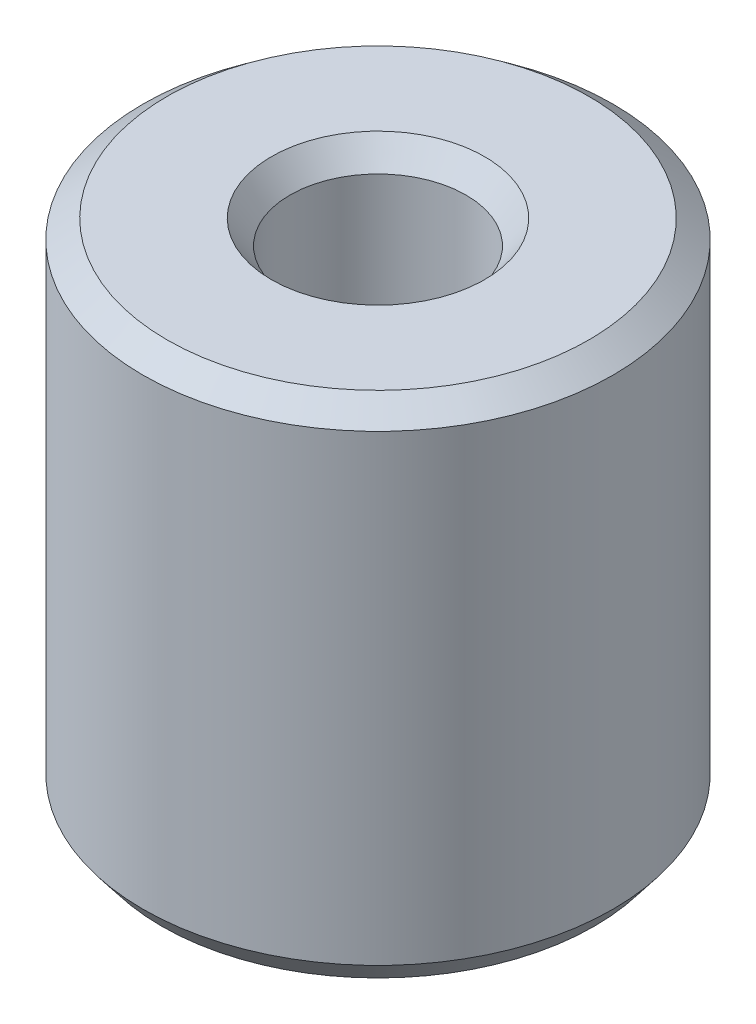
from build123d import *
from OCP.BRepFilletAPI import BRepFilletAPI_MakeChamfer

# Parameters (mm, degrees)
SKETCH1_R           = 7.5
BOSS_EXTRUDE1_DEPTH = 16.125207537
SKETCH2_R           = 2.811035462
CUT_EXTRUDE1_DEPTH  = 20.300837238
CHAMFER1_SIZE       = 0.592734587
CHAMFER1_SIZE2      = 0.766089051


with BuildPart() as part:
    # Sketch1 → Boss-Extrude1 (new body)
    with BuildSketch(Plane(origin=(0, 0, 0), x_dir=(1, 0, 0), z_dir=(0, 1, 0))):
        Circle(SKETCH1_R)
    extrude(amount=BOSS_EXTRUDE1_DEPTH)

    # Sketch2 → Cut-Extrude1 (cut, through all)
    with BuildSketch(Plane(origin=(0, 0, 0), x_dir=(1, 0, 0), z_dir=(0, 1, 0))):
        Circle(SKETCH2_R)
    extrude(amount=CUT_EXTRUDE1_DEPTH, mode=Mode.SUBTRACT)

    # Chamfer1: one chamfer whose edges measure the first distance from different faces: ONE call of the kernel's chamfer builder (chamfer() names one face for all edges)
    chamfer1_edges_1 = [part.edges().sort_by_distance(p)[0] for p in [
        (-2.811035462, 16.125207537, 0),
    ]]
    chamfer1_side_1 = [part.faces().sort_by_distance(p)[0] for p in [
        (-7.287867966, 16.125207537, 0),
    ]]
    chamfer1_edges_2 = [part.edges().sort_by_distance(p)[0] for p in [
        (-2.811035462, 0, 0),
    ]]
    chamfer1_side_2 = [part.faces().sort_by_distance(p)[0] for p in [
        (-2.811035462, 8.062603768, 0),
    ]]
    chamfer1_edges_3 = [part.edges().sort_by_distance(p)[0] for p in [
        (-7.5, 0, 0),
    ]]
    chamfer1_side_3 = [part.faces().sort_by_distance(p)[0] for p in [
        (-7.287867966, 0, 0),
    ]]
    chamfer1_edges_4 = [part.edges().sort_by_distance(p)[0] for p in [
        (-7.5, 16.125207537, 0),
    ]]
    chamfer1_side_4 = [part.faces().sort_by_distance(p)[0] for p in [
        (-7.5, 8.062603768, 0),
    ]]
    chamfer1 = BRepFilletAPI_MakeChamfer(part.part.solid().wrapped)
    for e in chamfer1_edges_1:
        chamfer1.Add(CHAMFER1_SIZE, CHAMFER1_SIZE2, e.wrapped, chamfer1_side_1[0].wrapped)  # the first distance lies on this face
    for e in chamfer1_edges_2:
        chamfer1.Add(CHAMFER1_SIZE, CHAMFER1_SIZE2, e.wrapped, chamfer1_side_2[0].wrapped)  # the first distance lies on this face
    for e in chamfer1_edges_3:
        chamfer1.Add(CHAMFER1_SIZE, CHAMFER1_SIZE2, e.wrapped, chamfer1_side_3[0].wrapped)  # the first distance lies on this face
    for e in chamfer1_edges_4:
        chamfer1.Add(CHAMFER1_SIZE, CHAMFER1_SIZE2, e.wrapped, chamfer1_side_4[0].wrapped)  # the first distance lies on this face
    add(Compound.cast(chamfer1.Shape()), mode=Mode.REPLACE)


solid = part.part
